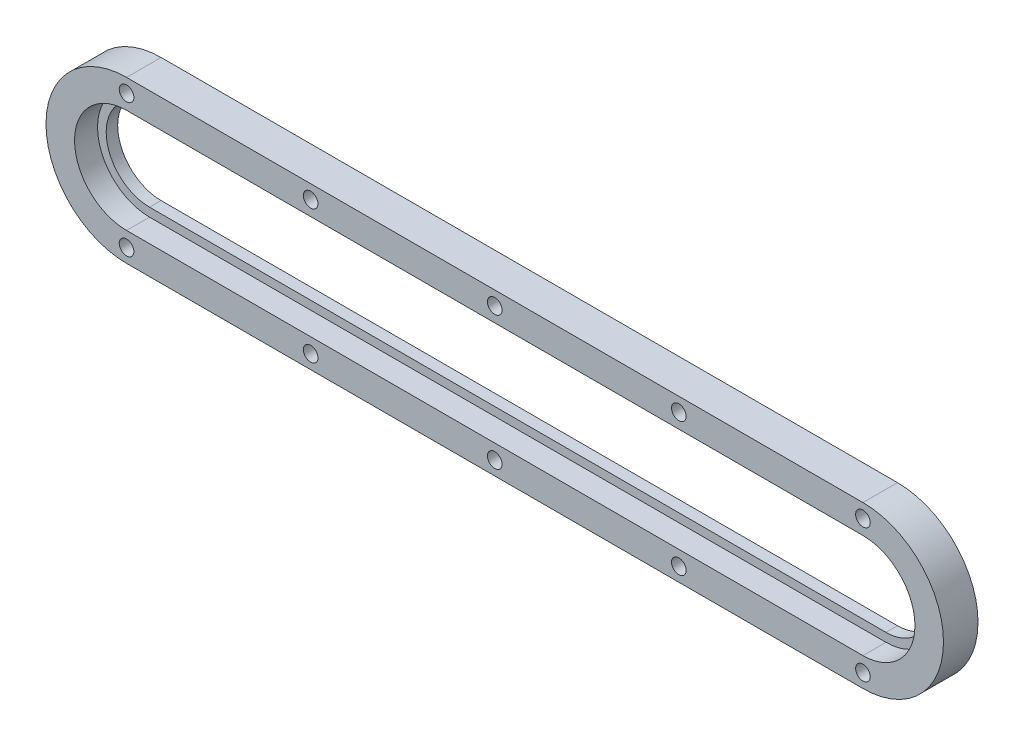
from build123d import *

# Parameters (mm, degrees)
SKETCH1_W              = 247.65
SKETCH1_H              = 44.45
BOSS_EXTRUDE1_DEPTH    = 9.525
CUT_EXTRUDE1_DEPTH     = 6.35
CUT_EXTRUDE3_DEPTH     = 126.963898598
CUT_EXTRUDE2_DEPTH     = 127.163809688
F_10_32_TAPPED_HOLE1_D = 4.0386


with BuildPart() as part:
    # Sketch1 → Boss-Extrude1 (new body)
    with BuildSketch(Plane.XY):
        Rectangle(SKETCH1_W, SKETCH1_H)
    extrude(amount=BOSS_EXTRUDE1_DEPTH)

    # Sketch2 → Cut-Extrude1 (cut)
    with BuildSketch(Plane.XY.offset(9.525)):
        with BuildLine():
            Line((101.6, -14.351), (-101.6, -14.351))
            ThreePointArc((-101.6, -14.351), (-115.951, 0), (-101.6, 14.351))
            Line((-101.6, 14.351), (101.6, 14.351))
            ThreePointArc((101.6, 14.351), (115.951, 0), (101.6, -14.351))
        make_face()
    extrude(amount=-CUT_EXTRUDE1_DEPTH, mode=Mode.SUBTRACT)

    # Sketch14 → Cut-Extrude3 (cut, through all)
    with BuildSketch(Plane.XY.offset(3.175)):
        with BuildLine():
            Line((101.6, 11.96975), (-101.6, 11.96975))
            ThreePointArc((-101.6, 11.96975), (-113.56975, 0), (-101.6, -11.96975))
            Line((-101.6, -11.96975), (101.6, -11.96975))
            ThreePointArc((101.6, -11.96975), (113.56975, 0), (101.6, 11.96975))
        make_face()
    extrude(amount=-CUT_EXTRUDE3_DEPTH, mode=Mode.SUBTRACT)

    # Sketch3 → Cut-Extrude2 (cut, through all)
    with BuildSketch(Plane.XY.offset(9.525)):
        with BuildLine():
            ThreePointArc((-123.825, -1.74e-07), (-117.315448274, 15.71544815), (-101.6, 22.225))
            Line((-101.6, 22.225), (-123.825, 22.225))
            Line((-123.825, 22.225), (-123.825, -1.74e-07))
        make_face()
        with BuildLine():
            Line((123.825, 22.225), (101.6, 22.225))
            ThreePointArc((101.6, 22.225), (117.315448235, 15.715448189), (123.825, -6.4e-08))
            Line((123.825, -6.4e-08), (123.825, 22.225))
        make_face()
        with BuildLine():
            ThreePointArc((-101.6, -22.225), (-117.31544815, -15.715448274), (-123.825, -1.74e-07))
            Line((-123.825, -1.74e-07), (-123.825, -22.225))
            Line((-123.825, -22.225), (-101.6, -22.225))
        make_face()
        with BuildLine():
            Line((123.825, -22.225), (123.825, -6.4e-08))
            ThreePointArc((123.825, -6.4e-08), (117.315448189, -15.715448235), (101.6, -22.225))
            Line((101.6, -22.225), (123.825, -22.225))
        make_face()
    extrude(amount=-CUT_EXTRUDE2_DEPTH, mode=Mode.SUBTRACT)

    # #10-32 Tapped Hole1 (through all)
    with Locations(Plane.XY.offset(9.525)):
        with Locations((-101.6, 18.415), (-50.8, 18.415), (0, 18.415), (50.8, 18.415), (101.6, 18.415), (101.6, -18.415), (50.8, -18.415), (0, -18.415), (-50.8, -18.415), (-101.6, -18.415)):
            Hole(F_10_32_TAPPED_HOLE1_D / 2)


solid = part.part
